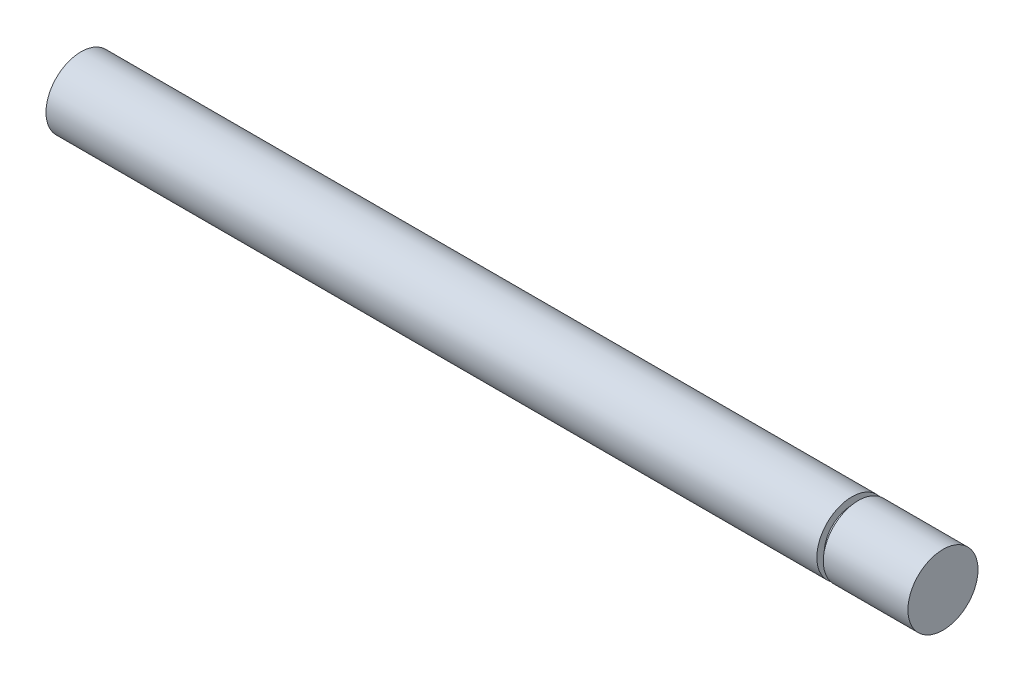
from build123d import *

# Parameters (mm, degrees)
SKETCH1_R                   = 6.35
BOSS_EXTRUDE1_DEPTH         = 69.85
BOSS_EXTRUDE2_START         = 16.51
SKETCH3_R                   = 6.35
BOSS_EXTRUDE2_DEPTH         = 16.51
SKETCH2_W                   = 1.1684
SKETCH2_H                   = 1.3208
F_1_4_20_TAPPED_HOLE1_D     = 5.1054
F_1_4_20_TAPPED_HOLE1_DEPTH = 16.51
F_1_4_20_TAPPED_HOLE1_TIP   = 1.533816902


with BuildPart() as part:
    # Sketch1 → Boss-Extrude1 (new, symmetric)
    with BuildSketch(Plane(origin=(0, 0, 0), x_dir=(0, 0, -1), z_dir=(1, 0, 0))):
        Circle(SKETCH1_R)
    extrude(amount=BOSS_EXTRUDE1_DEPTH, both=True)

    # Sketch3 → Boss-Extrude2 (add)
    with BuildSketch(Plane(origin=(69.85, 0, 0), x_dir=(0, 0, -1), z_dir=(1, 0, 0)).offset(BOSS_EXTRUDE2_START)):
        Circle(SKETCH3_R)
    extrude(amount=-BOSS_EXTRUDE2_DEPTH)

    # Sketch2 → Cut-Revolve1 (revolve, cut)
    with BuildSketch(Plane.XY):
        with Locations((70.4342, 5.6896)):
            Rectangle(SKETCH2_W, SKETCH2_H)
    revolve(axis=Axis((0, 0, 0), (1, 0, 0)), mode=Mode.SUBTRACT)

    # 1/4-20 Tapped Hole1
    with Locations(Plane.ZY.offset(69.85)):
        with Locations((0, 0)):
            Hole(F_1_4_20_TAPPED_HOLE1_D / 2, depth=F_1_4_20_TAPPED_HOLE1_DEPTH)
            with Locations((0, 0, -(F_1_4_20_TAPPED_HOLE1_DEPTH + F_1_4_20_TAPPED_HOLE1_TIP / 2))):  # 118° drill point
                Cone(0, F_1_4_20_TAPPED_HOLE1_D / 2, F_1_4_20_TAPPED_HOLE1_TIP, mode=Mode.SUBTRACT)


solid = part.part
